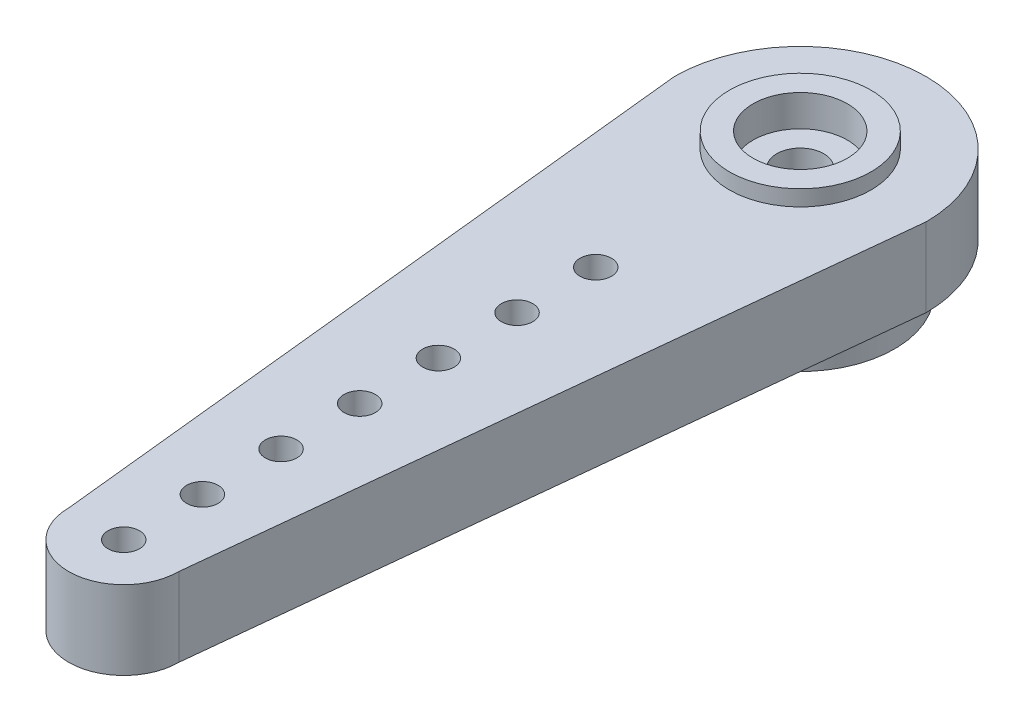
from build123d import *

# Parameters (mm, degrees)
SKETCH1_R           = 6
BOSS_EXTRUDE1_DEPTH = 3
CUT_EXTRUDE4_DEPTH  = 10
BOSS_EXTRUDE2_DEPTH = 5
SKETCH3_R           = 4.5
BOSS_EXTRUDE3_DEPTH = 1
SKETCH4_R           = 3
CUT_EXTRUDE1_DEPTH  = 2
SKETCH5_R           = 1.5
CUT_EXTRUDE2_DEPTH  = 48.699580711
SKETCH6_R           = 1
CUT_EXTRUDE3_DEPTH  = 10
SKETCH8_R           = 1.5
CUT_EXTRUDE5_DEPTH  = 2


with BuildPart() as part:
    # Sketch1 → Boss-Extrude1 (new body)
    with BuildSketch(Plane(origin=(0, 0, 0), x_dir=(1, 0, 0), z_dir=(0, 1, 0))):
        Circle(SKETCH1_R)
    extrude(amount=BOSS_EXTRUDE1_DEPTH)

    # Sketch7 → Cut-Extrude4 (cut, through all)
    with BuildSketch(Plane.XZ):
        with BuildLine():
            Line((0.7, 3.684087404), (0, 3.05))
            Line((0, 3.05), (-0.7, 3.684087404))
            ThreePointArc((-0.7, 3.684087404), (-0.779668841, 3.668053503), (-0.858971523, 3.650296964))
            Line((-0.858971523, 3.650296964), (-1.240546761, 2.786313646))
            Line((-1.240546761, 2.786313646), (-2.137935164, 3.080865663))
            ThreePointArc((-2.137935164, 3.080865663), (-2.204194696, 3.033813729), (-2.269419066, 2.985337016))
            Line((-2.269419066, 2.985337016), (-2.266591718, 2.040848349))
            Line((-2.266591718, 2.040848349), (-3.206201915, 1.944934261))
            ThreePointArc((-3.206201915, 1.944934261), (-3.247595264, 1.875), (-3.287463436, 1.804185178))
            Line((-3.287463436, 1.804185178), (-2.900722375, 0.942501833))
            Line((-2.900722375, 0.942501833), (-3.720087228, 0.472706055))
            ThreePointArc((-3.720087228, 0.472706055), (-3.729457108, 0.391981737), (-3.737075512, 0.311073332))
            Line((-3.737075512, 0.311073332), (-3.033291781, -0.318811813))
            Line((-3.033291781, -0.318811813), (-3.590735663, -1.081257322))
            ThreePointArc((-3.590735663, -1.081257322), (-3.566461936, -1.158813729), (-3.540513282, -1.235825919))
            Line((-3.540513282, -1.235825919), (-2.641377482, -1.525))
            Line((-2.641377482, -1.525), (-2.840513282, -2.448261485))
            ThreePointArc((-2.840513282, -2.448261485), (-2.786793096, -2.509239774), (-2.73176414, -2.569039642))
            Line((-2.73176414, -2.569039642), (-1.792745019, -2.467501833))
            Line((-1.792745019, -2.467501833), (-1.599140348, -3.391938995))
            ThreePointArc((-1.599140348, -3.391938995), (-1.525262412, -3.425795466), (-1.450668162, -3.458043072))
            Line((-1.450668162, -3.458043072), (-0.634130657, -2.983350182))
            Line((-0.634130657, -2.983350182), (-0.081261521, -3.749119439))
            ThreePointArc((-0.081261521, -3.749119439), (0, -3.75), (0.081261521, -3.749119439))
            Line((0.081261521, -3.749119439), (0.634130657, -2.983350182))
            Line((0.634130657, -2.983350182), (1.450668162, -3.458043072))
            ThreePointArc((1.450668162, -3.458043072), (1.525262412, -3.425795466), (1.599140348, -3.391938995))
            Line((1.599140348, -3.391938995), (1.792745019, -2.467501833))
            Line((1.792745019, -2.467501833), (2.73176414, -2.569039642))
            ThreePointArc((2.73176414, -2.569039642), (2.786793096, -2.509239774), (2.840513282, -2.448261485))
            Line((2.840513282, -2.448261485), (2.641377482, -1.525))
            Line((2.641377482, -1.525), (3.540513282, -1.235825919))
            ThreePointArc((3.540513282, -1.235825919), (3.566461936, -1.158813729), (3.590735663, -1.081257322))
            Line((3.590735663, -1.081257322), (3.033291781, -0.318811813))
            Line((3.033291781, -0.318811813), (3.737075512, 0.311073332))
            ThreePointArc((3.737075512, 0.311073332), (3.729457108, 0.391981737), (3.720087228, 0.472706055))
            Line((3.720087228, 0.472706055), (2.900722375, 0.942501833))
            Line((2.900722375, 0.942501833), (3.287463436, 1.804185178))
            ThreePointArc((3.287463436, 1.804185178), (3.247595264, 1.875), (3.206201915, 1.944934261))
            Line((3.206201915, 1.944934261), (2.266591718, 2.040848349))
            Line((2.266591718, 2.040848349), (2.269419066, 2.985337016))
            ThreePointArc((2.269419066, 2.985337016), (2.204194696, 3.033813729), (2.137935164, 3.080865663))
            Line((2.137935164, 3.080865663), (1.240546761, 2.786313646))
            Line((1.240546761, 2.786313646), (0.858971523, 3.650296964))
            ThreePointArc((0.858971523, 3.650296964), (0.779668841, 3.668053503), (0.7, 3.684087404))
        make_face()
    extrude(amount=-CUT_EXTRUDE4_DEPTH, mode=Mode.SUBTRACT)

    # Sketch2 → Boss-Extrude2 (add)
    with BuildSketch(Plane(origin=(0, 3, 0), x_dir=(1, 0, 0), z_dir=(0, 1, 0))):
        with BuildLine():
            Line((8, 0), (3.5, -43))
            ThreePointArc((3.5, -43), (0, -46.5), (-3.5, -43))
            Line((-3.5, -43), (-8, 0))
            ThreePointArc((-8, 0), (0, 8), (8, 0))
        make_face()
    extrude(amount=BOSS_EXTRUDE2_DEPTH)

    # Sketch3 → Boss-Extrude3 (add)
    with BuildSketch(Plane(origin=(0, 8, 0), x_dir=(1, 0, 0), z_dir=(0, 1, 0))):
        Circle(SKETCH3_R)
    extrude(amount=BOSS_EXTRUDE3_DEPTH)

    # Sketch4 → Cut-Extrude1 (cut)
    with BuildSketch(Plane(origin=(0, 9, 0), x_dir=(1, 0, 0), z_dir=(0, 1, 0))):
        Circle(SKETCH4_R)
    extrude(amount=-CUT_EXTRUDE1_DEPTH, mode=Mode.SUBTRACT)

    # Sketch5 → Cut-Extrude2 (cut, through all)
    with BuildSketch(Plane(origin=(0, 7, 0), x_dir=(1, 0, 0), z_dir=(0, 1, 0))):
        Circle(SKETCH5_R)
    extrude(amount=-CUT_EXTRUDE2_DEPTH, mode=Mode.SUBTRACT)

    # Sketch6 → Cut-Extrude3 (cut)
    with BuildSketch(Plane(origin=(0, 8, 0), x_dir=(1, 0, 0), z_dir=(0, 1, 0))):
        with Locations((0, -13)):
            Circle(SKETCH6_R)
        with Locations((0, -18)):
            Circle(SKETCH6_R)
        with Locations((0, -23)):
            Circle(SKETCH6_R)
        with Locations((0, -28)):
            Circle(SKETCH6_R)
        with Locations((0, -33)):
            Circle(SKETCH6_R)
        with Locations((0, -38)):
            Circle(SKETCH6_R)
        with Locations((0, -43)):
            Circle(SKETCH6_R)
    extrude(amount=-CUT_EXTRUDE3_DEPTH, mode=Mode.SUBTRACT)

    # Sketch8 → Cut-Extrude5 (cut)
    with BuildSketch(Plane.XZ.offset(-3)):
        with BuildLine():
            Line((-0.858971523, 3.650296964), (-1.240546761, 2.786313646))
            Line((-1.240546761, 2.786313646), (-2.137935164, 3.080865663))
            ThreePointArc((-2.137935164, 3.080865663), (-2.204194696, 3.033813729), (-2.269419066, 2.985337016))
            Line((-2.269419066, 2.985337016), (-2.266591718, 2.040848349))
            Line((-2.266591718, 2.040848349), (-3.206201915, 1.944934261))
            ThreePointArc((-3.206201915, 1.944934261), (-3.247595264, 1.875), (-3.287463436, 1.804185178))
            Line((-3.287463436, 1.804185178), (-2.900722375, 0.942501833))
            Line((-2.900722375, 0.942501833), (-3.720087228, 0.472706055))
            ThreePointArc((-3.720087228, 0.472706055), (-3.729457108, 0.391981737), (-3.737075512, 0.311073332))
            Line((-3.737075512, 0.311073332), (-3.033291781, -0.318811813))
            Line((-3.033291781, -0.318811813), (-3.590735663, -1.081257322))
            ThreePointArc((-3.590735663, -1.081257322), (-3.566461936, -1.158813729), (-3.540513282, -1.235825919))
            Line((-3.540513282, -1.235825919), (-2.641377482, -1.525))
            Line((-2.641377482, -1.525), (-2.840513282, -2.448261485))
            ThreePointArc((-2.840513282, -2.448261485), (-2.786793096, -2.509239774), (-2.73176414, -2.569039642))
            Line((-2.73176414, -2.569039642), (-1.792745019, -2.467501833))
            Line((-1.792745019, -2.467501833), (-1.599140348, -3.391938995))
            ThreePointArc((-1.599140348, -3.391938995), (-1.525262412, -3.425795466), (-1.450668162, -3.458043072))
            Line((-1.450668162, -3.458043072), (-0.634130657, -2.983350182))
            Line((-0.634130657, -2.983350182), (-0.081261521, -3.749119439))
            ThreePointArc((-0.081261521, -3.749119439), (0, -3.75), (0.081261521, -3.749119439))
            Line((0.081261521, -3.749119439), (0.634130657, -2.983350182))
            Line((0.634130657, -2.983350182), (1.450668162, -3.458043072))
            ThreePointArc((1.450668162, -3.458043072), (1.525262412, -3.425795466), (1.599140348, -3.391938995))
            Line((1.599140348, -3.391938995), (1.792745019, -2.467501833))
            Line((1.792745019, -2.467501833), (2.73176414, -2.569039642))
            ThreePointArc((2.73176414, -2.569039642), (2.786793096, -2.509239774), (2.840513282, -2.448261485))
            Line((2.840513282, -2.448261485), (2.641377482, -1.525))
            Line((2.641377482, -1.525), (3.540513282, -1.235825919))
            ThreePointArc((3.540513282, -1.235825919), (3.566461936, -1.158813729), (3.590735663, -1.081257322))
            Line((3.590735663, -1.081257322), (3.033291781, -0.318811813))
            Line((3.033291781, -0.318811813), (3.737075512, 0.311073332))
            ThreePointArc((3.737075512, 0.311073332), (3.729457108, 0.391981737), (3.720087228, 0.472706055))
            Line((3.720087228, 0.472706055), (2.900722375, 0.942501833))
            Line((2.900722375, 0.942501833), (3.287463436, 1.804185178))
            ThreePointArc((3.287463436, 1.804185178), (3.247595264, 1.875), (3.206201915, 1.944934261))
            Line((3.206201915, 1.944934261), (2.266591718, 2.040848349))
            Line((2.266591718, 2.040848349), (2.269419066, 2.985337016))
            ThreePointArc((2.269419066, 2.985337016), (2.204194696, 3.033813729), (2.137935164, 3.080865663))
            Line((2.137935164, 3.080865663), (1.240546761, 2.786313646))
            Line((1.240546761, 2.786313646), (0.858971523, 3.650296964))
            ThreePointArc((0.858971523, 3.650296964), (0.779668841, 3.668053503), (0.7, 3.684087404))
            Line((0.7, 3.684087404), (0, 3.05))
            Line((0, 3.05), (-0.7, 3.684087404))
            ThreePointArc((-0.7, 3.684087404), (-0.779668841, 3.668053503), (-0.858971523, 3.650296964))
        make_face()
        Circle(SKETCH8_R, mode=Mode.SUBTRACT)
    extrude(amount=-CUT_EXTRUDE5_DEPTH, mode=Mode.SUBTRACT)


solid = part.part
